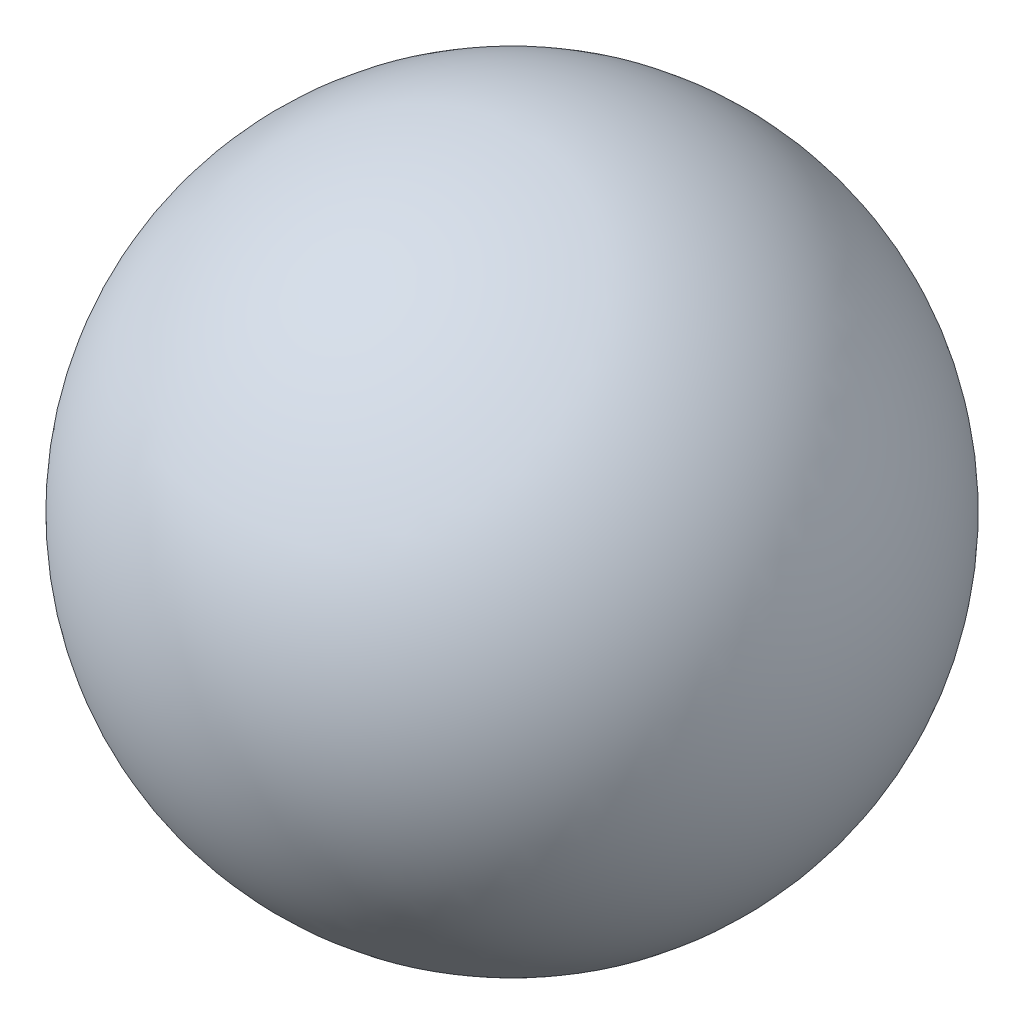
from build123d import *


with BuildPart() as part:
    # Sketch1 → Revolve3 (revolve)
    with BuildSketch(Plane(origin=(0, 0, 0), x_dir=(0, 0, -1), z_dir=(1, 0, 0))):
        with BuildLine():
            Line((0, 38.1), (0, -38.1))
            ThreePointArc((0, -38.1), (26.940768363, -26.940768363), (38.1, 0))
            ThreePointArc((38.1, 0), (26.940768363, 26.940768363), (0, 38.1))
        make_face()
    revolve(axis=Axis((0, -43.588392543, 0), (0, 1, 0)))


solid = part.part
